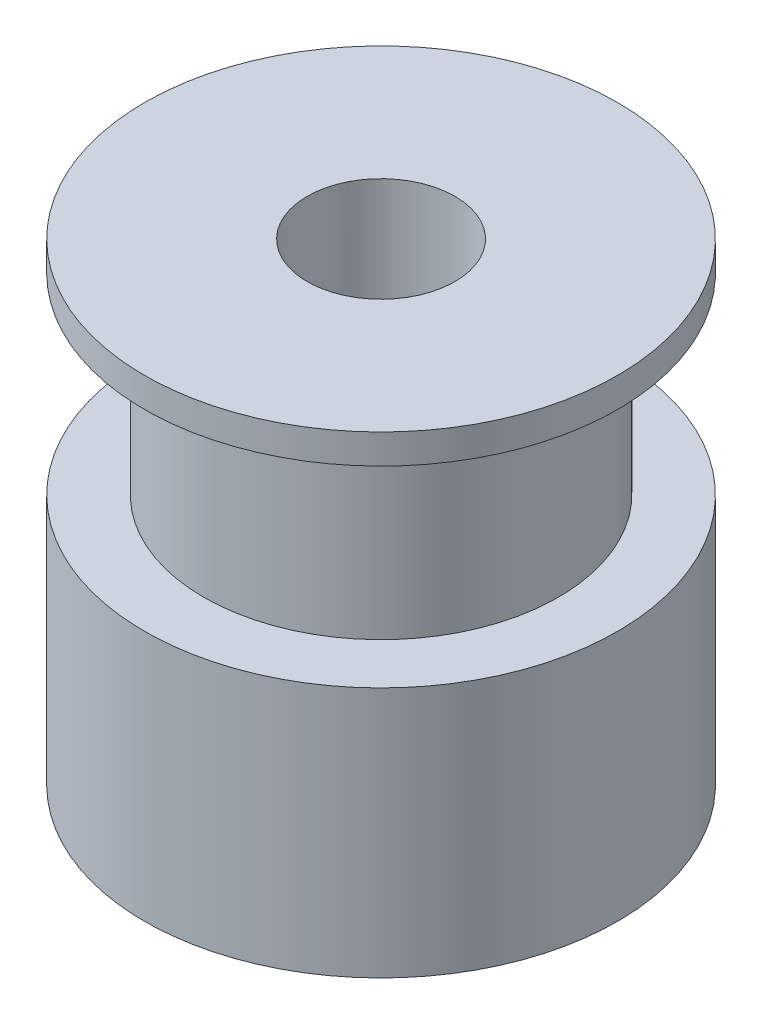
from build123d import *

# Parameters (mm, degrees)
ESQUISSE2_R             = 1.5
ENL_V_MAT_EXTRU_1_DEPTH = 20.595917942
ESQUISSE3_R             = 1.5
ENL_V_MAT_EXTRU_2_DEPTH = 20.595918106


with BuildPart() as part:
    # Esquisse1 → Révolution1 (revolve)
    with BuildSketch(Plane.XY):
        Polygon((-2.5, 0), (-2.5, 16), (-8, 16), (-8, 15), (-6, 15), (-6, 8.5), (-8, 8.5), (-8, 0), align=None)
    revolve(axis=Axis((0, 0, 0), (0, 1, 0)))

    # Esquisse2 → Enlèv. mat.-Extru.1 (cut, through all)
    with BuildSketch(Plane(origin=(0, 0, 0), x_dir=(0, 0, -1), z_dir=(1, 0, 0))):
        with Locations((0, 4.25)):
            Circle(ESQUISSE2_R)
    extrude(amount=-ENL_V_MAT_EXTRU_1_DEPTH, mode=Mode.SUBTRACT)

    # Esquisse3 → Enlèv. mat.-Extru.2 (cut, through all)
    with BuildSketch(Plane.XY):
        with Locations((0, 4.25)):
            Circle(ESQUISSE3_R)
    extrude(amount=-ENL_V_MAT_EXTRU_2_DEPTH, mode=Mode.SUBTRACT)


solid = part.part
